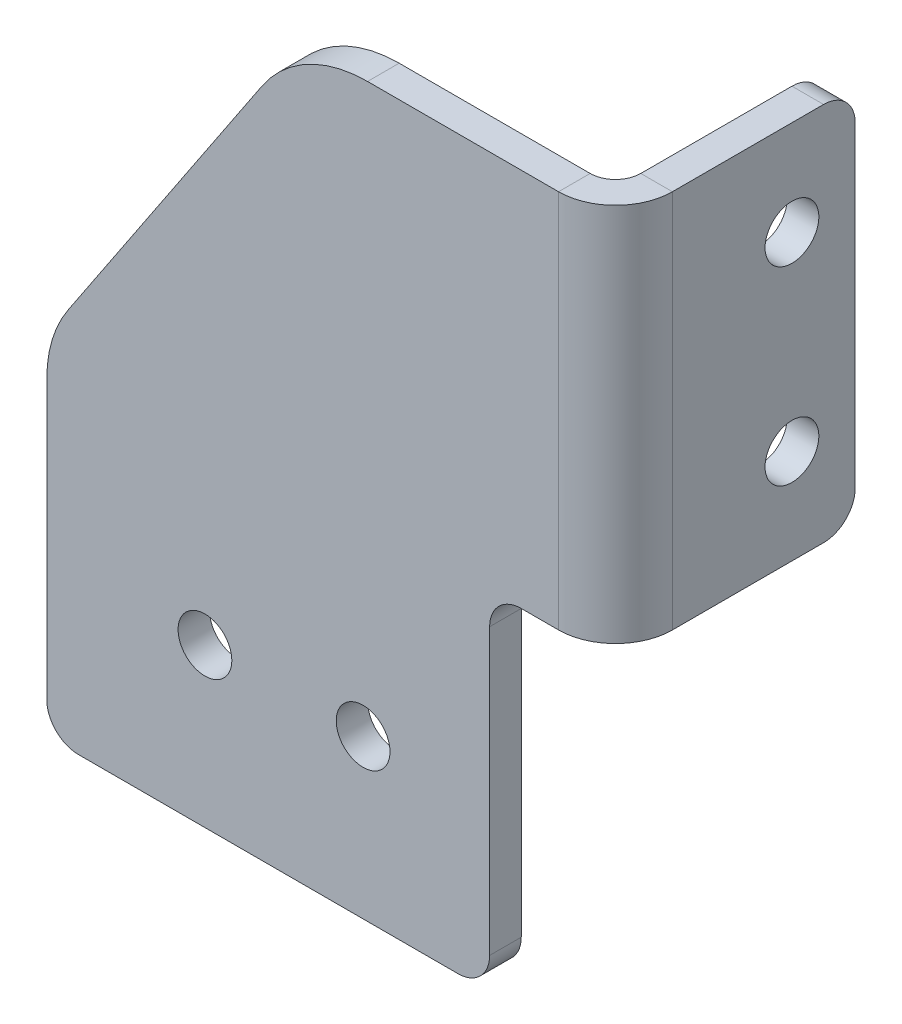
from build123d import *

# Parameters (mm, degrees)
TABAN_FLAN_1_DEPTH     = 5
IZGIDEN_START          = -60
IZGIDEN_B_KME2_DEPTH   = 60
IZGIDEN_B_KME2_2_DEPTH = 60
IZIM8_R                = 4.25
KES_EKSTR_ZYON1_DEPTH  = 10
RADYUS1_R              = 20
RADYUS2_R              = 5
IZIM9_R                = 4.25
KES_EKSTR_ZYON2_DEPTH  = 19


# Read off the part's stored shape, not the designer's step: Çizgiden Bükme2
# Sheet-metal steps are written as plain solids
with BuildPart() as part:
    # Çizim1 → Taban-Flanş1 (new body)
    with BuildSketch(Plane.XY):
        Polygon((0, 0), (-80, 0), (-120, -60), (-120, -115), (-50, -115), (-50, -60), (0, -60), align=None)
    extrude(amount=-TABAN_FLAN_1_DEPTH)

    # Çizgiden Bükme2 outline → Çizgiden Bükme2 (cut)
    with BuildSketch(Plane(origin=(0, 0, 0), x_dir=(1, 0, 0), z_dir=(0, 1, 0)).offset(IZGIDEN_START)):
        with BuildLine():
            Line((0, 5), (-31.042830313, 5))
            ThreePointArc((-31.042830313, 5), (-34.361671571, 1.351470729), (-39.105088062, 0))
            Line((-39.105088062, 0), (0, 0))
            Line((0, 0), (0, 5))
        make_face()
    extrude(amount=IZGIDEN_B_KME2_DEPTH, mode=Mode.SUBTRACT)

    # izgiden B_kme2 2 outline → izgiden B_kme2 2 (add)
    with BuildSketch(Plane(origin=(0, 0, 0), x_dir=(1, 0, 0), z_dir=(0, 1, 0)).offset(IZGIDEN_START)):
        with BuildLine():
            Line((-30.105088062, 37.894911938), (-35.105088062, 37.894911938))
            Line((-35.105088062, 37.894911938), (-35.105088062, 9))
            ThreePointArc((-35.105088062, 9), (-36.276660937, 6.171572875), (-39.105088062, 5))
            Line((-39.105088062, 5), (-31.042830313, 5))
            ThreePointArc((-31.042830313, 5), (-30.342659182, 6.945775053), (-30.105088062, 9))
            Line((-30.105088062, 9), (-30.105088062, 37.894911938))
        make_face()
    extrude(amount=IZGIDEN_B_KME2_2_DEPTH)

    # Çizim8 → Kes-Ekstrüzyon1 (cut)
    with BuildSketch(Plane.XY):
        with Locations((-70, -90)):
            Circle(IZIM8_R)
        with Locations((-95, -90)):
            Circle(IZIM8_R)
    extrude(amount=-KES_EKSTR_ZYON1_DEPTH, mode=Mode.SUBTRACT)

    # Radyus1
    radyus1_edges = [part.edges().sort_by_distance(p)[0] for p in [
        (-120, -60, -2.5),
        (-80, 0, -2.5),
    ]]
    fillet(radyus1_edges, radius=RADYUS1_R)

    # Radyus2
    radyus2_edges = [part.edges().sort_by_distance(p)[0] for p in [
        (-32.605088062, -60, -37.894911938),
        (-32.605088062, 0, -37.894911938),
        (-120, -115, -2.5),
        (-50, -115, -2.5),
        (-50, -60, -2.5),
    ]]
    fillet(radyus2_edges, radius=RADYUS2_R)

    # Çizim9 → Kes-Ekstrüzyon2 (cut)
    with BuildSketch(Plane.ZY.offset(35.105088062)):
        with Locations((-27.894911938, -15)):
            Circle(IZIM9_R)
        with Locations((-27.894911938, -45)):
            Circle(IZIM9_R)
    extrude(amount=-KES_EKSTR_ZYON2_DEPTH, mode=Mode.SUBTRACT)


solid = part.part
